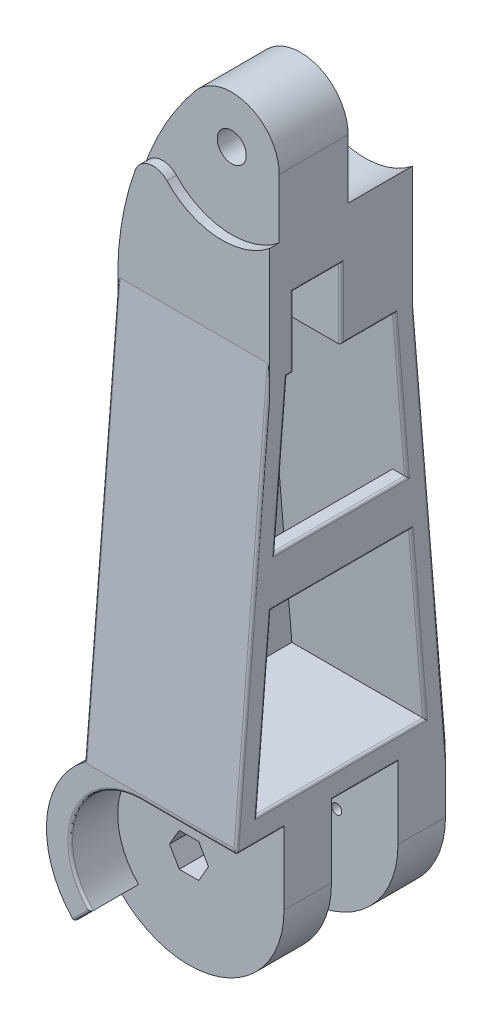
from build123d import *

# Parameters (mm, degrees)
EXTRUDE_1_DEPTH             = 22
CUT_EXTRUDE_2_DEPTH         = 2
CUT_EXTRUDE_2_DEPTH_BACK    = 12
SKETCH_17_R                 = 4
SKETCH_17_R_2               = 2.5
EXTRUDE_1181_DEPTH          = 1
CUT_EXTRUDE_4_DEPTH         = 10
CUT_EXTRUDE_5_DEPTH         = 6
CUT_EXTRUDE_6_DEPTH         = 152.662725821
CUT_EXTRUDE_START           = 13.5
CUT_EXTRUDE_7_DEPTH         = 13.5
CUT_EXTRUDE_8_DEPTH         = 2
SKETCH_15_R                 = 3.05
CUT_EXTRUDE_9_DEPTH         = 152.887565006
CUT_EXTRUDE_11_DEPTH        = 28
EXTRUDE_4_REACH             = 153.663
SKETCH_20_W                 = 3
SKETCH_20_H                 = 10
EXTRUDE_4_DIRECTION_2_REACH = 153.663
SKETCH_18_R                 = 4
SKETCH_18_R_2               = 2.55
EXTRUDE_3_DEPTH             = 1
CUT_EXTRUDE_12_REACH        = 157.559
SKETCH_19_R                 = 1.05
CUT_EXTRUDE_1_REACH         = 150.948
SKETCH_21_W                 = 10
SKETCH_21_H                 = 5
CUT_EXTRUDE_2_2_DEPTH       = 10
FILLET_2_R                  = 0.5


with BuildPart() as part:
    # 草图1 → 凸台-拉伸1 (new, symmetric)
    with BuildSketch(Plane.XY):
        with BuildLine():
            Line((0, 0), (0, 134.629120178))
            ThreePointArc((0, 134.629120178), (-6.639219361, 144.047461513), (-17.741030699, 140.959716021))
            ThreePointArc((-17.741030699, 140.959716021), (-28.328479077, 122.213775654), (-32, 101))
            Line((-32, 101), (-32, 16))
            ThreePointArc((-32, 16), (-28.94427191, -17.88854382), (0, 0))
        make_face()
    extrude(amount=EXTRUDE_1_DEPTH, both=True)

    # 草图4 → Cut-Extrude 2 (cut, two sides: drawn at the far end of the back side and taken through both)
    with BuildSketch(Plane(origin=(9.59053233, 7.02854156, 0), x_dir=(-0.3879015226350175, 0.9217008238780278, 0), z_dir=(0, 0, 1)).offset(-CUT_EXTRUDE_2_DEPTH_BACK)):
        with BuildLine():
            Line((11.067481905, 5.747460683), (18.825512358, 24.18147716))
            ThreePointArc((18.825512358, 24.18147716), (15.666408684, 40.546455603), (-0.661796586, 43.890430498))
            Line((-0.661796586, 43.890430498), (-2.549062114, 48.520573998))
            ThreePointArc((-2.549062114, 48.520573998), (-14.999680248, 30.11309285), (-2.758030453, 11.565983522))
            Line((-2.758030453, 11.565983522), (11.067481905, 5.747460683))
        make_face()
    extrude(amount=CUT_EXTRUDE_2_DEPTH + CUT_EXTRUDE_2_DEPTH_BACK, mode=Mode.SUBTRACT)

    # 草图17 → Extrude 1181 (add)
    with BuildSketch(Plane.XY.offset(-12)):
        with Locations((-20, 0)):
            Circle(SKETCH_17_R)
        with Locations((-20, 0)):
            Circle(SKETCH_17_R_2, mode=Mode.SUBTRACT)
    extrude(amount=EXTRUDE_1181_DEPTH)

    # 草图9 → 切除-拉伸4 (cut)
    with BuildSketch(Plane.XY.offset(22)):
        with BuildLine():
            Line((0, 0), (0, 15))
            Line((0, 15), (-20, 15))
            ThreePointArc((-20, 15), (-33.858192988, 5.740251485), (-30.606601718, -10.606601718))
            Line((-30.606601718, -10.606601718), (-34.142135624, -14.142135624))
            ThreePointArc((-34.142135624, -14.142135624), (-12.346331353, -18.47759065), (0, 0))
        make_face()
    extrude(amount=-CUT_EXTRUDE_4_DEPTH, mode=Mode.SUBTRACT)

    # 草图10 → 切除-旋转1 (revolve, cut)
    with BuildSketch(Plane.ZX, mode=Mode.PRIVATE) as cut_revolve_1_sk:
        Polygon((-22, -9.5), (-19, -9.5), (-19, -15.5), (-15, -15.5), (-15, -17.45), (12, -17.45), (12, -20), (-22, -20), align=None)
    revolve(cut_revolve_1_sk.sketch.rotate(Axis((-20, 0, -40.443482847), (0, 0, 1)), 180), axis=Axis((-20, 0, -40.443482847), (0, 0, 1)), mode=Mode.SUBTRACT)

    # 草图11 → 切除-拉伸5 (cut)
    with BuildSketch(Plane.XY.offset(12)):
        Polygon((-15.900813089, 0), (-17.950406544, 3.55), (-22.049593456, 3.55), (-24.099186911, 0), (-22.049593456, -3.55), (-17.950406544, -3.55), align=None)
    extrude(amount=-CUT_EXTRUDE_5_DEPTH, mode=Mode.SUBTRACT)

    # 草图12 → 切除-拉伸6 (cut, through all)
    with BuildSketch(Plane(origin=(0, 0, 0), x_dir=(0, 0, -1), z_dir=(1, 0, 0))):
        Polygon((-22, 16), (-15, 101), (-15, 144.629120178), (-22, 144.629120178), align=None)
    cut_extrude_6 = extrude(amount=-CUT_EXTRUDE_6_DEPTH, mode=Mode.SUBTRACT)

    # 镜向1: 切除-拉伸6 across plane
    add(cut_extrude_6.mirror(Plane.XY), mode=Mode.SUBTRACT)

    # 草图13 → 切除-拉伸7 (cut)
    with BuildSketch(Plane.XY.offset(-15).offset(CUT_EXTRUDE_START)):
        with BuildLine():
            ThreePointArc((0, 122.139124182), (4.422205102, 127.700916948), (6, 134.629120178))
            ThreePointArc((6, 134.629120178), (-12.571863565, 150.421064891), (-25.173189725, 129.552279274))
            ThreePointArc((-25.173189725, 129.552279274), (-21.765574137, 135.456967681), (-17.741030699, 140.959716021))
            ThreePointArc((-17.741030699, 140.959716021), (-6.639219361, 144.047461513), (0, 134.629120178))
            Line((0, 134.629120178), (0, 122.139124182))
        make_face()
        with BuildLine():
            ThreePointArc((-17.741030699, 140.959716021), (-21.765574137, 135.456967681), (-25.173189725, 129.552279274))
            ThreePointArc((-25.173189725, 129.552279274), (-23.726924285, 126.408928594), (-21.638692568, 123.650011139))
            ThreePointArc((-21.638692568, 123.650011139), (-11.114460938, 118.667980594), (0, 122.139124182))
            Line((0, 122.139124182), (0, 134.629120178))
            ThreePointArc((0, 134.629120178), (-6.639219361, 144.047461513), (-17.741030699, 140.959716021))
        make_face()
        with BuildLine():
            ThreePointArc((-21.638692568, 123.650011139), (-23.726924285, 126.408928594), (-25.173189725, 129.552279274))
            ThreePointArc((-25.173189725, 129.552279274), (-26.85902514, 125.951617289), (-28.314837565, 122.251966229))
            ThreePointArc((-28.314837565, 122.251966229), (-25.3682183, 124.820312429), (-21.638692568, 123.650011139))
        make_face()
    extrude(amount=-CUT_EXTRUDE_7_DEPTH, mode=Mode.SUBTRACT)

    # 草图14 → 切除-拉伸8 (cut)
    with BuildSketch(Plane.XY.offset(15)):
        with BuildLine():
            ThreePointArc((0, 122.139124182), (4.422205102, 127.700916948), (6, 134.629120178))
            ThreePointArc((6, 134.629120178), (-12.571863565, 150.421064891), (-25.173189725, 129.552279274))
            ThreePointArc((-25.173189725, 129.552279274), (-21.765574137, 135.456967681), (-17.741030699, 140.959716021))
            ThreePointArc((-17.741030699, 140.959716021), (-6.639219361, 144.047461513), (0, 134.629120178))
            Line((0, 134.629120178), (0, 122.139124182))
        make_face()
        with BuildLine():
            ThreePointArc((-17.741030699, 140.959716021), (-21.765574137, 135.456967681), (-25.173189725, 129.552279274))
            ThreePointArc((-25.173189725, 129.552279274), (-23.726924305, 126.408928628), (-21.638692623, 123.650011197))
            ThreePointArc((-21.638692623, 123.650011197), (-11.114460978, 118.667980597), (0, 122.139124182))
            Line((0, 122.139124182), (0, 134.629120178))
            ThreePointArc((0, 134.629120178), (-6.639219361, 144.047461513), (-17.741030699, 140.959716021))
        make_face()
        with BuildLine():
            ThreePointArc((-21.638692623, 123.650011197), (-23.726924305, 126.408928628), (-25.173189725, 129.552279274))
            ThreePointArc((-25.173189725, 129.552279274), (-26.859025168, 125.951617222), (-28.314837613, 122.251966093))
            ThreePointArc((-28.314837613, 122.251966093), (-25.36821841, 124.820312407), (-21.638692623, 123.650011197))
        make_face()
    extrude(amount=-CUT_EXTRUDE_8_DEPTH, mode=Mode.SUBTRACT)

    # 草图15 → 切除-拉伸9 (cut, through all)
    with BuildSketch(Plane(origin=(0, 0, -1.5), x_dir=(-1, 0, 0), z_dir=(0, 0, -1))):
        with Locations(Location((10, 134.629120178, 0), (0, 0, 90))):
            Circle(SKETCH_15_R)
    extrude(amount=-CUT_EXTRUDE_9_DEPTH, mode=Mode.SUBTRACT)

    # 草图16 → 切除-拉伸11 (cut)
    with BuildSketch(Plane.ZY):
        Polygon((11.315870671, 97), (17.657047142, 20), (-17.657047142, 20), (-11.315870671, 97), align=None)
    extrude(amount=CUT_EXTRUDE_11_DEPTH, mode=Mode.SUBTRACT)

    # 凸台-拉伸4: up to this plane
    extrude_4_end = Plane(origin=(-116.711777546, 97, 11.315870671), z_dir=(0, -0.0820750945403042, -0.9966261479894054))
    # 草图20 → 凸台-拉伸4 (add, up to the surface)
    with BuildSketch(Plane.XY, mode=Mode.PRIVATE) as extrude_4_sk1:
        with Locations((-1.5, 61)):
            Rectangle(SKETCH_20_W, SKETCH_20_H)
    extrude_4_tool1 = split(extrude(extrude_4_sk1.sketch, amount=EXTRUDE_4_REACH, mode=Mode.PRIVATE), bisect_by=extrude_4_end, keep=Keep.BOTH, mode=Mode.PRIVATE)
    add(extrude_4_tool1.solids().sort_by_distance((-1.5, 61, 0))[0])

    # 凸台-拉伸4 direction 2: up to this plane
    extrude_4_direction_2_end = Plane(origin=(-116.711777546, 20, -17.657047142), z_dir=(0, -0.08207509454030391, 0.9966261479894054))
    # 草图20 → 凸台-拉伸4 direction 2 (add, up to the surface)
    with BuildSketch(Plane.XY, mode=Mode.PRIVATE) as extrude_4_direction_2_sk1:
        with Locations((-1.5, 61)):
            Rectangle(SKETCH_20_W, SKETCH_20_H)
    extrude_4_direction_2_tool1 = split(extrude(extrude_4_direction_2_sk1.sketch, amount=-EXTRUDE_4_DIRECTION_2_REACH, mode=Mode.PRIVATE), bisect_by=extrude_4_direction_2_end, keep=Keep.BOTH, mode=Mode.PRIVATE)
    add(extrude_4_direction_2_tool1.solids().sort_by_distance((-1.5, 61, 0))[0])

    # 草图18 → 凸台-拉伸3 (add)
    with BuildSketch(Plane(origin=(0, 0, 2), x_dir=(-1, 0, 0), z_dir=(0, 0, -1))):
        with Locations(Location((20, 0, 0), (0, 0, 180))):
            Circle(SKETCH_18_R)
        with Locations((20, 0)):
            Circle(SKETCH_18_R_2, mode=Mode.SUBTRACT)
    extrude(amount=EXTRUDE_3_DEPTH)

    # 草图19 → 切除-拉伸12 (cut, up to next)
    with BuildSketch(Plane(origin=(0, 0, -19), x_dir=(-1, 0, 0), z_dir=(0, 0, -1)), mode=Mode.PRIVATE) as cut_extrude_12_sk1:
        with Locations((12.9, 0)):
            Circle(SKETCH_19_R)
    cut_extrude_12_tool1 = extrude(cut_extrude_12_sk1.sketch, amount=-CUT_EXTRUDE_12_REACH, mode=Mode.PRIVATE) & part.part
    # 草图19 → 切除-拉伸12 (cut, up to next)
    with BuildSketch(Plane(origin=(0, 0, -19), x_dir=(-1, 0, 0), z_dir=(0, 0, -1)), mode=Mode.PRIVATE) as cut_extrude_12_sk2:
        with Locations((27.1, 0)):
            Circle(SKETCH_19_R)
    cut_extrude_12_tool2 = extrude(cut_extrude_12_sk2.sketch, amount=-CUT_EXTRUDE_12_REACH, mode=Mode.PRIVATE) & part.part
    add(cut_extrude_12_tool1.solids().sort_by_distance((-12.9, 0, -19))[0], mode=Mode.SUBTRACT)
    add(cut_extrude_12_tool2.solids().sort_by_distance((-27.1, 0, -19))[0], mode=Mode.SUBTRACT)

    # 草图21 → 走延长线-切除-拉伸1 (cut, up to next)
    with BuildSketch(Plane(origin=(-28, 0, 0), x_dir=(0, 0, -1), z_dir=(1, 0, 0)), mode=Mode.PRIVATE) as cut_extrude_1_sk1:
        with Locations((0, 22.5)):
            Rectangle(SKETCH_21_W, SKETCH_21_H)
    cut_extrude_1_tool1 = extrude(cut_extrude_1_sk1.sketch, amount=-CUT_EXTRUDE_1_REACH, mode=Mode.PRIVATE) & part.part
    add(cut_extrude_1_tool1.solids().sort_by_distance((-28, 22.5, 0))[0], mode=Mode.SUBTRACT)

    # 草图22 → Cut-Extrude 2 2 (cut)
    with BuildSketch(Plane.XY):
        Polygon((0, 112), (-28, 97), (0, 97), align=None)
    extrude(amount=CUT_EXTRUDE_2_2_DEPTH, mode=Mode.SUBTRACT)

    # 圆角2
    # the kernel refuses this fillet: 0.5 mm, written as the material it takes off along each edge
    with BuildSketch(Plane(origin=(-32, 102.245782685, -14.897406132), x_dir=(0, -0.08207509454030396, 0.9966261479894054), z_dir=(0, -0.9966261479894054, -0.08207509454030396))) as fillet_2_piece_1_section:
        with BuildLine():
            CenterArc((FILLET_2_R, -FILLET_2_R), FILLET_2_R, 90, 90)
            Line((0, -FILLET_2_R), (0, 0))
            Line((0, 0), (FILLET_2_R, 0))
        make_face()
    fillet_2_piece_1 = extrude(amount=92.787748241, mode=Mode.PRIVATE)
    fillet_2_piece_1 = fillet_2_piece_1 - Plane(origin=(-20, 0, -14.897406132), x_dir=(-0.6, 0.8, 0), z_dir=(0, 0, 1)) * Cylinder(20, 188, mode=Mode.PRIVATE)
    fillet_2_piece_1 = split(fillet_2_piece_1, bisect_by=Plane(origin=(-32, 102.245782685, -15), z_dir=(0, 0, -1)), keep=Keep.TOP, mode=Mode.PRIVATE)
    add(fillet_2_piece_1, mode=Mode.SUBTRACT)
    with BuildSketch(Plane(origin=(-32, 102.245782685, -14.897406132), x_dir=(0, -0.08207509454030396, 0.9966261479894054), z_dir=(0, -0.9966261479894054, -0.08207509454030396))) as fillet_2_piece_2_section:
        with BuildLine():
            CenterArc((FILLET_2_R, -FILLET_2_R), FILLET_2_R, 90, 90)
            Line((0, -FILLET_2_R), (0, 0))
            Line((0, 0), (FILLET_2_R, 0))
        make_face()
    fillet_2_piece_2 = extrude(amount=92.787748241, mode=Mode.PRIVATE)
    fillet_2_piece_2 = fillet_2_piece_2 - Plane(origin=(31.121571832, 101, -14.897406132), x_dir=(-0.7741030698804483, 0.6330595842427994, 0), z_dir=(0, 0, 1)) * Cylinder(63.121571832, 188, mode=Mode.PRIVATE)
    fillet_2_piece_2 = split(fillet_2_piece_2, bisect_by=Plane(origin=(-32, 102.245782685, -15), z_dir=(0, 0, 1)), keep=Keep.TOP, mode=Mode.PRIVATE)
    add(fillet_2_piece_2, mode=Mode.SUBTRACT)
    with BuildSketch(Plane(origin=(-32, 102.245782685, 14.897406132), x_dir=(0, -0.08207509454030396, -0.9966261479894054), z_dir=(0, -0.9966261479894054, 0.08207509454030396))) as fillet_2_piece_3_section:
        with BuildLine():
            CenterArc((FILLET_2_R, FILLET_2_R), FILLET_2_R, 180, 90)
            Line((0, FILLET_2_R), (0, 0))
            Line((0, 0), (FILLET_2_R, 0))
        make_face()
    fillet_2_piece_3 = extrude(amount=92.787748241, mode=Mode.PRIVATE)
    fillet_2_piece_3 = fillet_2_piece_3 - Plane(origin=(-20, 0, 14.897406132), x_dir=(-0.6, 0.8, 0), z_dir=(0, 0, 1)) * Cylinder(20, 188, mode=Mode.PRIVATE)
    fillet_2_piece_3 = split(fillet_2_piece_3, bisect_by=Plane(origin=(-32, 102.245782685, 15), z_dir=(0, 0, 1)), keep=Keep.TOP, mode=Mode.PRIVATE)
    add(fillet_2_piece_3, mode=Mode.SUBTRACT)
    with BuildSketch(Plane(origin=(-32, 102.245782685, 14.897406132), x_dir=(0, -0.08207509454030396, -0.9966261479894054), z_dir=(0, -0.9966261479894054, 0.08207509454030396))) as fillet_2_piece_4_section:
        with BuildLine():
            CenterArc((FILLET_2_R, FILLET_2_R), FILLET_2_R, 180, 90)
            Line((0, FILLET_2_R), (0, 0))
            Line((0, 0), (FILLET_2_R, 0))
        make_face()
    fillet_2_piece_4 = extrude(amount=92.787748241, mode=Mode.PRIVATE)
    fillet_2_piece_4 = fillet_2_piece_4 - Plane(origin=(31.121571832, 101, 14.897406132), x_dir=(-0.7741030698804483, 0.6330595842427994, 0), z_dir=(0, 0, 1)) * Cylinder(63.121571832, 188, mode=Mode.PRIVATE)
    fillet_2_piece_4 = split(fillet_2_piece_4, bisect_by=Plane(origin=(-32, 102.245782685, 15), z_dir=(0, 0, -1)), keep=Keep.TOP, mode=Mode.PRIVATE)
    add(fillet_2_piece_4, mode=Mode.SUBTRACT)
    with BuildSketch(Plane(origin=(0, 9.771086575, 22.512969341), x_dir=(-1, 0, 0), z_dir=(0, 0.9966261479894054, -0.08207509454030396))) as fillet_2_piece_5_section:
        with BuildLine():
            CenterArc((FILLET_2_R, -FILLET_2_R), FILLET_2_R, 90, 90)
            Line((0, -FILLET_2_R), (0, 0))
            Line((0, 0), (FILLET_2_R, 0))
        make_face()
    fillet_2_piece_5 = extrude(amount=92.787748241, mode=Mode.PRIVATE)
    fillet_2_piece_5 = split(fillet_2_piece_5, bisect_by=Plane(origin=(0, 9.771086575, 15), z_dir=(0, 0, 1)), keep=Keep.TOP, mode=Mode.PRIVATE)
    add(fillet_2_piece_5, mode=Mode.SUBTRACT)
    with BuildSketch(Plane(origin=(0, 9.771086575, -22.512969341), x_dir=(-1, 0, 0), z_dir=(0, 0.9966261479894054, 0.08207509454030396))) as fillet_2_piece_6_section:
        with BuildLine():
            CenterArc((FILLET_2_R, FILLET_2_R), FILLET_2_R, 180, 90)
            Line((0, FILLET_2_R), (0, 0))
            Line((0, 0), (FILLET_2_R, 0))
        make_face()
    fillet_2_piece_6 = extrude(amount=92.787748241, mode=Mode.PRIVATE)
    fillet_2_piece_6 = split(fillet_2_piece_6, bisect_by=Plane(origin=(0, 9.771086575, -15), z_dir=(0, 0, -1)), keep=Keep.TOP, mode=Mode.PRIVATE)
    add(fillet_2_piece_6, mode=Mode.SUBTRACT)
    with BuildSketch(Plane(origin=(0, 20, 18.907047142), x_dir=(-1, 0, 0), z_dir=(0, 0, -1))) as fillet_2_piece_7_section:
        with BuildLine():
            CenterArc((FILLET_2_R, -FILLET_2_R), FILLET_2_R, 90, 90)
            Line((0, -FILLET_2_R), (0, 0))
            Line((0, 0), (FILLET_2_R, 0))
        make_face()
    fillet_2_piece_7 = extrude(amount=37.814094283, mode=Mode.PRIVATE)
    fillet_2_piece_7 = split(fillet_2_piece_7, bisect_by=Plane(origin=(0, 22.99087656, -17.41073966), z_dir=(0, -0.08207509454030391, 0.9966261479894054)), keep=Keep.TOP, mode=Mode.PRIVATE)
    fillet_2_piece_7 = split(fillet_2_piece_7, bisect_by=Plane(origin=(0, 19.897752268, 17.665467543), z_dir=(0, -0.08207509454030419, -0.9966261479894054)), keep=Keep.TOP, mode=Mode.PRIVATE)
    add(fillet_2_piece_7, mode=Mode.SUBTRACT)
    with BuildSketch(Plane(origin=(0, 18.754217315, -17.75964101), x_dir=(0, 0.08207509454030391, -0.9966261479894054), z_dir=(0, 0.9966261479894054, 0.08207509454030391))) as fillet_2_piece_8_section:
        with BuildLine():
            CenterArc((FILLET_2_R, FILLET_2_R), FILLET_2_R, 180, 90)
            Line((0, FILLET_2_R), (0, 0))
            Line((0, 0), (FILLET_2_R, 0))
        make_face()
    fillet_2_piece_8 = extrude(amount=38.621869843, mode=Mode.PRIVATE)
    fillet_2_piece_8 = split(fillet_2_piece_8, bisect_by=Plane(origin=(0, 20, -17.75964101), z_dir=(0, 1, 0)), keep=Keep.TOP, mode=Mode.PRIVATE)
    fillet_2_piece_8 = split(fillet_2_piece_8, bisect_by=Plane(origin=(0, 56, -17.75964101), z_dir=(0, -1, 0)), keep=Keep.TOP, mode=Mode.PRIVATE)
    add(fillet_2_piece_8, mode=Mode.SUBTRACT)
    with BuildSketch(Plane(origin=(0, 64.754217315, -13.971405716), x_dir=(0, 0.08207509454030393, -0.9966261479894055), z_dir=(0, 0.9966261479894054, 0.08207509454030391))) as fillet_2_piece_9_section:
        with BuildLine():
            CenterArc((FILLET_2_R, FILLET_2_R), FILLET_2_R, 180, 90)
            Line((0, FILLET_2_R), (0, 0))
            Line((0, 0), (FILLET_2_R, 0))
        make_face()
    fillet_2_piece_9 = extrude(amount=33.604943476, mode=Mode.PRIVATE)
    fillet_2_piece_9 = split(fillet_2_piece_9, bisect_by=Plane(origin=(0, 66, -13.971405716), z_dir=(0, 1, 0)), keep=Keep.TOP, mode=Mode.PRIVATE)
    fillet_2_piece_9 = split(fillet_2_piece_9, bisect_by=Plane(origin=(0, 97, -13.971405716), z_dir=(0, -1, 0)), keep=Keep.TOP, mode=Mode.PRIVATE)
    add(fillet_2_piece_9, mode=Mode.SUBTRACT)
    with BuildSketch(Plane(origin=(0, 97, -12.565870671), x_dir=(0, 1, 0), z_dir=(0, 0, 1))) as fillet_2_piece_10_section:
        with BuildLine():
            CenterArc((FILLET_2_R, FILLET_2_R), FILLET_2_R, 180, 90)
            Line((0, FILLET_2_R), (0, 0))
            Line((0, 0), (FILLET_2_R, 0))
        make_face()
    fillet_2_piece_10 = extrude(amount=13.815870671, mode=Mode.PRIVATE)
    fillet_2_piece_10 = split(fillet_2_piece_10, bisect_by=Plane(origin=(0, 96.897752268, -11.324291072), z_dir=(0, -0.08207509454030391, 0.9966261479894054)), keep=Keep.TOP, mode=Mode.PRIVATE)
    add(fillet_2_piece_10, mode=Mode.SUBTRACT)
    with BuildSketch(Plane(origin=(0, 97, 8.75), x_dir=(0, 1, 0), z_dir=(0, 0, 1))) as fillet_2_piece_11_section:
        with BuildLine():
            CenterArc((FILLET_2_R, FILLET_2_R), FILLET_2_R, 180, 90)
            Line((0, FILLET_2_R), (0, 0))
            Line((0, 0), (FILLET_2_R, 0))
        make_face()
    fillet_2_piece_11 = extrude(amount=3.815870671, mode=Mode.PRIVATE)
    fillet_2_piece_11 = split(fillet_2_piece_11, bisect_by=Plane(origin=(0, 97.209883565, 11.298586142), z_dir=(0, -0.08207509454030419, -0.9966261479894054)), keep=Keep.TOP, mode=Mode.PRIVATE)
    add(fillet_2_piece_11, mode=Mode.SUBTRACT)
    with BuildSketch(Plane(origin=(0, 57.245782685, 14.589747391), x_dir=(0, 0.08207509454030419, 0.9966261479894054), z_dir=(0, -0.9966261479894054, 0.08207509454030419))) as fillet_2_piece_12_section:
        with BuildLine():
            CenterArc((FILLET_2_R, FILLET_2_R), FILLET_2_R, 180, 90)
            Line((0, FILLET_2_R), (0, 0))
            Line((0, 0), (FILLET_2_R, 0))
        make_face()
    fillet_2_piece_12 = extrude(amount=38.621869843, mode=Mode.PRIVATE)
    fillet_2_piece_12 = split(fillet_2_piece_12, bisect_by=Plane(origin=(0, 20, 14.589747391), z_dir=(0, 1, 0)), keep=Keep.TOP, mode=Mode.PRIVATE)
    fillet_2_piece_12 = split(fillet_2_piece_12, bisect_by=Plane(origin=(0, 56, 14.589747391), z_dir=(0, -1, 0)), keep=Keep.TOP, mode=Mode.PRIVATE)
    add(fillet_2_piece_12, mode=Mode.SUBTRACT)
    with BuildSketch(Plane(origin=(0, 98.245782685, 11.213276803), x_dir=(0, 0.0820750945403042, 0.9966261479894055), z_dir=(0, -0.9966261479894054, 0.08207509454030419))) as fillet_2_piece_13_section:
        with BuildLine():
            CenterArc((FILLET_2_R, FILLET_2_R), FILLET_2_R, 180, 90)
            Line((0, FILLET_2_R), (0, 0))
            Line((0, 0), (FILLET_2_R, 0))
        make_face()
    fillet_2_piece_13 = extrude(amount=33.604943476, mode=Mode.PRIVATE)
    fillet_2_piece_13 = split(fillet_2_piece_13, bisect_by=Plane(origin=(0, 66, 11.213276803), z_dir=(0, 1, 0)), keep=Keep.TOP, mode=Mode.PRIVATE)
    fillet_2_piece_13 = split(fillet_2_piece_13, bisect_by=Plane(origin=(0, 97, 11.213276803), z_dir=(0, -1, 0)), keep=Keep.TOP, mode=Mode.PRIVATE)
    add(fillet_2_piece_13, mode=Mode.SUBTRACT)
    with BuildSketch(Plane(origin=(1.25, 15, 22), x_dir=(0, 1, 0), z_dir=(-1, 0, 0))) as fillet_2_piece_14:
        with BuildLine():
            CenterArc((FILLET_2_R, FILLET_2_R), FILLET_2_R, 180, 90)
            Line((0, FILLET_2_R), (0, 0))
            Line((0, 0), (FILLET_2_R, 0))
        make_face()
    extrude(amount=21.25, mode=Mode.SUBTRACT)
    with BuildSketch(Plane(origin=(-34.142135624, -14.142135624, 2), x_dir=(-0.6979824404521097, 0.7161148740394359, 0), z_dir=(0, 0, -1))) as fillet_2_piece_15:
        with BuildLine():
            CenterArc((0.506451887, 0.4999589), FILLET_2_R, 179.265358209, 91.469283581)
            Line((0.006492986, 0.506369684), (0, 0))
            ThreePointArc((0, 0), (0.256431335, -0.001643993), (0.51286267, 0))
        make_face()
    extrude(amount=14, mode=Mode.SUBTRACT)
    with BuildSketch(Plane(origin=(-29.722718241, -9.722718241, 22), x_dir=(-0.7071067811865442, 0.7071067811865509, 0), z_dir=(-0.7071067811865509, -0.7071067811865442, 0))) as fillet_2_piece_16:
        with BuildLine():
            CenterArc((FILLET_2_R, FILLET_2_R), FILLET_2_R, 180, 90)
            Line((0, FILLET_2_R), (0, 0))
            Line((0, 0), (FILLET_2_R, 0))
        make_face()
    extrude(amount=7.5, mode=Mode.SUBTRACT)
    with BuildSketch(Plane(origin=(-34.142135624, -14.142135624, 23.282156675), x_dir=(-0.6979824404521096, 0.7161148740394361, 0), z_dir=(0, 0, -1))) as fillet_2_piece_17:
        with BuildLine():
            CenterArc((0.506451887, 0.4999589), FILLET_2_R, 179.265358209, 91.469283581)
            Line((0.006492986, 0.506369684), (0, 0))
            ThreePointArc((0, 0), (0.256431335, -0.001643993), (0.51286267, 0))
        make_face()
    extrude(amount=11.282156675, mode=Mode.SUBTRACT)
    with BuildSketch(Plane(origin=(-20, 0, 22), x_dir=(0, 1, 0), z_dir=(1, 0, 0))) as fillet_2_piece_18:
        with BuildLine():
            CenterArc((15 + FILLET_2_R, -FILLET_2_R), FILLET_2_R, 90, 90)
            Line((15, -FILLET_2_R), (15, 0))
            Line((15, 0), (15 + FILLET_2_R, 0))
        make_face()
    revolve(axis=Axis((-20, 0, 22), (0, 0, 1)), revolution_arc=139.778965344, mode=Mode.SUBTRACT)
    with BuildSketch(Plane(origin=(0, 15, 23.25), x_dir=(0, 1, 0), z_dir=(0, 0, -1))) as fillet_2_piece_19:
        with BuildLine():
            CenterArc((FILLET_2_R, -FILLET_2_R), FILLET_2_R, 90, 90)
            Line((0, -FILLET_2_R), (0, 0))
            Line((0, 0), (FILLET_2_R, 0))
        make_face()
    extrude(amount=11.25, mode=Mode.SUBTRACT)
    with BuildSketch(Plane(origin=(0, 15, -12), x_dir=(0, 1, 0), z_dir=(0, 0, 1))) as fillet_2_piece_20:
        with BuildLine():
            CenterArc((FILLET_2_R, FILLET_2_R), FILLET_2_R, 180, 90)
            Line((0, FILLET_2_R), (0, 0))
            Line((0, 0), (FILLET_2_R, 0))
        make_face()
    extrude(amount=14, mode=Mode.SUBTRACT)
    with BuildSketch(Plane(origin=(0, 56, 15.942341259), x_dir=(0, 1, 0), z_dir=(0, 0, -1))) as fillet_2_piece_21_section:
        with BuildLine():
            CenterArc((FILLET_2_R, -FILLET_2_R), FILLET_2_R, 90, 90)
            Line((0, -FILLET_2_R), (0, 0))
            Line((0, 0), (FILLET_2_R, 0))
        make_face()
    fillet_2_piece_21 = extrude(amount=31.884682519, mode=Mode.PRIVATE)
    fillet_2_piece_21 = split(fillet_2_piece_21, bisect_by=Plane(origin=(0, 58.505861438, -14.4859762), z_dir=(0, -0.08207509454030391, 0.9966261479894054)), keep=Keep.TOP, mode=Mode.PRIVATE)
    fillet_2_piece_21 = split(fillet_2_piece_21, bisect_by=Plane(origin=(0, 55.897752268, 14.700761661), z_dir=(0, -0.08207509454030419, -0.9966261479894054)), keep=Keep.TOP, mode=Mode.PRIVATE)
    add(fillet_2_piece_21, mode=Mode.SUBTRACT)
    with BuildSketch(Plane(origin=(0, 66, -15.118811847), x_dir=(0, -1, 0), z_dir=(0, 0, 1))) as fillet_2_piece_22_section:
        with BuildLine():
            CenterArc((FILLET_2_R, -FILLET_2_R), FILLET_2_R, 90, 90)
            Line((0, -FILLET_2_R), (0, 0))
            Line((0, 0), (FILLET_2_R, 0))
        make_face()
    fillet_2_piece_22 = extrude(amount=30.237623695, mode=Mode.PRIVATE)
    fillet_2_piece_22 = split(fillet_2_piece_22, bisect_by=Plane(origin=(0, 65.897752268, -13.877232249), z_dir=(0, -0.08207509454030391, 0.9966261479894054)), keep=Keep.TOP, mode=Mode.PRIVATE)
    fillet_2_piece_22 = split(fillet_2_piece_22, bisect_by=Plane(origin=(0, 68.371135015, 13.673541905), z_dir=(0, -0.08207509454030419, -0.9966261479894054)), keep=Keep.TOP, mode=Mode.PRIVATE)
    add(fillet_2_piece_22, mode=Mode.SUBTRACT)
    with BuildSketch(Plane(origin=(-32, 25, -5), x_dir=(0, 1, 0), z_dir=(0, 0, 1)), Plane(origin=(-32, 20, 5), x_dir=(0, -1, 0), z_dir=(0, 0, -1))) as fillet_2_piece_23:
        with BuildLine():
            CenterArc((FILLET_2_R, -FILLET_2_R), FILLET_2_R, 90, 90)
            Line((0, -FILLET_2_R), (0, 0))
            Line((0, 0), (FILLET_2_R, 0))
        make_face()
    extrude(amount=10, mode=Mode.SUBTRACT)
    with BuildSketch(Plane(origin=(-32, 20, -5), x_dir=(0, 0, -1), z_dir=(0, 1, 0)), Plane(origin=(-32, 25, 5), x_dir=(0, 0, 1), z_dir=(0, -1, 0))) as fillet_2_piece_24:
        with BuildLine():
            CenterArc((FILLET_2_R, -FILLET_2_R), FILLET_2_R, 90, 90)
            Line((0, -FILLET_2_R), (0, 0))
            Line((0, 0), (FILLET_2_R, 0))
        make_face()
    extrude(amount=5, mode=Mode.SUBTRACT)
    with BuildSketch(Plane(origin=(0, 95.75, 10), x_dir=(0, 0, 1), z_dir=(0, 1, 0))) as fillet_2_piece_25_section:
        with BuildLine():
            CenterArc((FILLET_2_R, -FILLET_2_R), FILLET_2_R, 90, 90)
            Line((0, -FILLET_2_R), (0, 0))
            Line((0, 0), (FILLET_2_R, 0))
        make_face()
    fillet_2_piece_25 = extrude(amount=17.5, mode=Mode.PRIVATE)
    fillet_2_piece_25 = split(fillet_2_piece_25, bisect_by=Plane(origin=(-6.764122894, 108.376362735, 10), z_dir=(0.4722214125154187, -0.8814799700287823, 0)), keep=Keep.TOP, mode=Mode.PRIVATE)
    add(fillet_2_piece_25, mode=Mode.SUBTRACT)
    with BuildSketch(Plane(origin=(0, 112, 0), x_dir=(0, 1, 0), z_dir=(0, 0, 1))) as fillet_2_piece_26:
        with BuildLine():
            CenterArc((FILLET_2_R * 0.598741441019, FILLET_2_R), FILLET_2_R, 208.17859011, 61.82140989)
            Line((-FILLET_2_R * 0.28273852901, FILLET_2_R * 0.527778587485), (0, 0))
            Line((0, 0), (FILLET_2_R * 0.598741441019, 0))
        make_face()
    extrude(amount=10, mode=Mode.SUBTRACT)
    with BuildSketch(Plane(origin=(0, 95.75, 0), x_dir=(0, 0, -1), z_dir=(0, 1, 0))) as fillet_2_piece_27_section:
        with BuildLine():
            CenterArc((FILLET_2_R, FILLET_2_R), FILLET_2_R, 180, 90)
            Line((0, FILLET_2_R), (0, 0))
            Line((0, 0), (FILLET_2_R, 0))
        make_face()
    fillet_2_piece_27 = extrude(amount=17.5, mode=Mode.PRIVATE)
    fillet_2_piece_27 = split(fillet_2_piece_27, bisect_by=Plane(origin=(-6.764122894, 108.376362735, 0), z_dir=(0.4722214125154187, -0.8814799700287823, 0)), keep=Keep.TOP, mode=Mode.PRIVATE)
    add(fillet_2_piece_27, mode=Mode.SUBTRACT)
    with BuildSketch(Plane(origin=(0, 20, 18.907047142), x_dir=(-1, 0, 0), z_dir=(0, 0, -1))) as fillet_2_piece_28a_section:
        with BuildLine():
            CenterArc((FILLET_2_R, -FILLET_2_R), FILLET_2_R, 90, 90)
            Line((0, -FILLET_2_R), (0, 0))
            Line((0, 0), (FILLET_2_R, 0))
        make_face()
    fillet_2_piece_28a = extrude(amount=37.814094283, mode=Mode.PRIVATE)
    fillet_2_piece_28a = split(fillet_2_piece_28a, bisect_by=Plane(origin=(0, 19.897752268, 17.665467543), z_dir=(0, 0.08207509454030419, 0.9966261479894054)), keep=Keep.TOP, mode=Mode.PRIVATE)
    with BuildSketch(Plane(origin=(0, 57.245782685, 14.589747391), x_dir=(0, 0.08207509454030419, 0.9966261479894054), z_dir=(0, -0.9966261479894054, 0.08207509454030419))) as fillet_2_piece_28b_section:
        with BuildLine():
            CenterArc((FILLET_2_R, FILLET_2_R), FILLET_2_R, 180, 90)
            Line((0, FILLET_2_R), (0, 0))
            Line((0, 0), (FILLET_2_R, 0))
        make_face()
    fillet_2_piece_28b = extrude(amount=38.621869843, mode=Mode.PRIVATE)
    fillet_2_piece_28b = split(fillet_2_piece_28b, bisect_by=Plane(origin=(0, 20, 14.589747391), z_dir=(0, -1, 0)), keep=Keep.TOP, mode=Mode.PRIVATE)
    fillet_2_piece_28 = fillet_2_piece_28a & fillet_2_piece_28b
    add(fillet_2_piece_28, mode=Mode.SUBTRACT)
    with BuildSketch(Plane(origin=(0, 20, 18.907047142), x_dir=(-1, 0, 0), z_dir=(0, 0, -1))) as fillet_2_piece_29a_section:
        with BuildLine():
            CenterArc((FILLET_2_R, -FILLET_2_R), FILLET_2_R, 90, 90)
            Line((0, -FILLET_2_R), (0, 0))
            Line((0, 0), (FILLET_2_R, 0))
        make_face()
    fillet_2_piece_29a = extrude(amount=37.814094283, mode=Mode.PRIVATE)
    fillet_2_piece_29a = split(fillet_2_piece_29a, bisect_by=Plane(origin=(0, 22.99087656, -17.41073966), z_dir=(0, 0.08207509454030391, -0.9966261479894054)), keep=Keep.TOP, mode=Mode.PRIVATE)
    with BuildSketch(Plane(origin=(0, 18.754217315, -17.75964101), x_dir=(0, 0.08207509454030391, -0.9966261479894054), z_dir=(0, 0.9966261479894054, 0.08207509454030391))) as fillet_2_piece_29b_section:
        with BuildLine():
            CenterArc((FILLET_2_R, FILLET_2_R), FILLET_2_R, 180, 90)
            Line((0, FILLET_2_R), (0, 0))
            Line((0, 0), (FILLET_2_R, 0))
        make_face()
    fillet_2_piece_29b = extrude(amount=38.621869843, mode=Mode.PRIVATE)
    fillet_2_piece_29b = split(fillet_2_piece_29b, bisect_by=Plane(origin=(0, 20, -17.75964101), z_dir=(0, -1, 0)), keep=Keep.TOP, mode=Mode.PRIVATE)
    fillet_2_piece_29 = fillet_2_piece_29a & fillet_2_piece_29b
    add(fillet_2_piece_29, mode=Mode.SUBTRACT)
    with BuildSketch(Plane(origin=(0, 18.754217315, -17.75964101), x_dir=(0, 0.08207509454030391, -0.9966261479894054), z_dir=(0, 0.9966261479894054, 0.08207509454030391))) as fillet_2_piece_30a_section:
        with BuildLine():
            CenterArc((FILLET_2_R, FILLET_2_R), FILLET_2_R, 180, 90)
            Line((0, FILLET_2_R), (0, 0))
            Line((0, 0), (FILLET_2_R, 0))
        make_face()
    fillet_2_piece_30a = extrude(amount=38.621869843, mode=Mode.PRIVATE)
    fillet_2_piece_30a = split(fillet_2_piece_30a, bisect_by=Plane(origin=(0, 56, -17.75964101), z_dir=(0, 1, 0)), keep=Keep.TOP, mode=Mode.PRIVATE)
    with BuildSketch(Plane(origin=(0, 56, 15.942341259), x_dir=(0, 1, 0), z_dir=(0, 0, -1))) as fillet_2_piece_30b_section:
        with BuildLine():
            CenterArc((FILLET_2_R, -FILLET_2_R), FILLET_2_R, 90, 90)
            Line((0, -FILLET_2_R), (0, 0))
            Line((0, 0), (FILLET_2_R, 0))
        make_face()
    fillet_2_piece_30b = extrude(amount=31.884682519, mode=Mode.PRIVATE)
    fillet_2_piece_30b = split(fillet_2_piece_30b, bisect_by=Plane(origin=(0, 58.505861438, -14.4859762), z_dir=(0, 0.08207509454030391, -0.9966261479894054)), keep=Keep.TOP, mode=Mode.PRIVATE)
    fillet_2_piece_30 = fillet_2_piece_30a & fillet_2_piece_30b
    add(fillet_2_piece_30, mode=Mode.SUBTRACT)
    with BuildSketch(Plane(origin=(0, 66, -15.118811847), x_dir=(0, -1, 0), z_dir=(0, 0, 1))) as fillet_2_piece_31a_section:
        with BuildLine():
            CenterArc((FILLET_2_R, -FILLET_2_R), FILLET_2_R, 90, 90)
            Line((0, -FILLET_2_R), (0, 0))
            Line((0, 0), (FILLET_2_R, 0))
        make_face()
    fillet_2_piece_31a = extrude(amount=30.237623695, mode=Mode.PRIVATE)
    fillet_2_piece_31a = split(fillet_2_piece_31a, bisect_by=Plane(origin=(0, 65.897752268, -13.877232249), z_dir=(0, 0.08207509454030391, -0.9966261479894054)), keep=Keep.TOP, mode=Mode.PRIVATE)
    with BuildSketch(Plane(origin=(0, 64.754217315, -13.971405716), x_dir=(0, 0.08207509454030393, -0.9966261479894055), z_dir=(0, 0.9966261479894054, 0.08207509454030391))) as fillet_2_piece_31b_section:
        with BuildLine():
            CenterArc((FILLET_2_R, FILLET_2_R), FILLET_2_R, 180, 90)
            Line((0, FILLET_2_R), (0, 0))
            Line((0, 0), (FILLET_2_R, 0))
        make_face()
    fillet_2_piece_31b = extrude(amount=33.604943476, mode=Mode.PRIVATE)
    fillet_2_piece_31b = split(fillet_2_piece_31b, bisect_by=Plane(origin=(0, 66, -13.971405716), z_dir=(0, -1, 0)), keep=Keep.TOP, mode=Mode.PRIVATE)
    fillet_2_piece_31 = fillet_2_piece_31a & fillet_2_piece_31b
    add(fillet_2_piece_31, mode=Mode.SUBTRACT)
    with BuildSketch(Plane(origin=(0, 64.754217315, -13.971405716), x_dir=(0, 0.08207509454030393, -0.9966261479894055), z_dir=(0, 0.9966261479894054, 0.08207509454030391))) as fillet_2_piece_32a_section:
        with BuildLine():
            CenterArc((FILLET_2_R, FILLET_2_R), FILLET_2_R, 180, 90)
            Line((0, FILLET_2_R), (0, 0))
            Line((0, 0), (FILLET_2_R, 0))
        make_face()
    fillet_2_piece_32a = extrude(amount=33.604943476, mode=Mode.PRIVATE)
    fillet_2_piece_32a = split(fillet_2_piece_32a, bisect_by=Plane(origin=(0, 97, -13.971405716), z_dir=(0, 1, 0)), keep=Keep.TOP, mode=Mode.PRIVATE)
    with BuildSketch(Plane(origin=(0, 97, -12.565870671), x_dir=(0, 1, 0), z_dir=(0, 0, 1))) as fillet_2_piece_32b_section:
        with BuildLine():
            CenterArc((FILLET_2_R, FILLET_2_R), FILLET_2_R, 180, 90)
            Line((0, FILLET_2_R), (0, 0))
            Line((0, 0), (FILLET_2_R, 0))
        make_face()
    fillet_2_piece_32b = extrude(amount=12.565870671, mode=Mode.PRIVATE)
    fillet_2_piece_32b = split(fillet_2_piece_32b, bisect_by=Plane(origin=(0, 96.897752268, -11.324291072), z_dir=(0, 0.08207509454030391, -0.9966261479894054)), keep=Keep.TOP, mode=Mode.PRIVATE)
    fillet_2_piece_32 = fillet_2_piece_32a & fillet_2_piece_32b
    add(fillet_2_piece_32, mode=Mode.SUBTRACT)
    with BuildSketch(Plane(origin=(0, 98.245782685, 11.213276803), x_dir=(0, 0.0820750945403042, 0.9966261479894055), z_dir=(0, -0.9966261479894054, 0.08207509454030419))) as fillet_2_piece_33a_section:
        with BuildLine():
            CenterArc((FILLET_2_R, FILLET_2_R), FILLET_2_R, 180, 90)
            Line((0, FILLET_2_R), (0, 0))
            Line((0, 0), (FILLET_2_R, 0))
        make_face()
    fillet_2_piece_33a = extrude(amount=33.604943476, mode=Mode.PRIVATE)
    fillet_2_piece_33a = split(fillet_2_piece_33a, bisect_by=Plane(origin=(0, 97, 11.213276803), z_dir=(0, 1, 0)), keep=Keep.TOP, mode=Mode.PRIVATE)
    with BuildSketch(Plane(origin=(0, 97, 10), x_dir=(0, 1, 0), z_dir=(0, 0, 1))) as fillet_2_piece_33b_section:
        with BuildLine():
            CenterArc((FILLET_2_R, FILLET_2_R), FILLET_2_R, 180, 90)
            Line((0, FILLET_2_R), (0, 0))
            Line((0, 0), (FILLET_2_R, 0))
        make_face()
    fillet_2_piece_33b = extrude(amount=2.565870671, mode=Mode.PRIVATE)
    fillet_2_piece_33b = split(fillet_2_piece_33b, bisect_by=Plane(origin=(0, 97.107635833, 11.307006544), z_dir=(0, 0.08207509454030419, 0.9966261479894054)), keep=Keep.TOP, mode=Mode.PRIVATE)
    fillet_2_piece_33 = fillet_2_piece_33a & fillet_2_piece_33b
    add(fillet_2_piece_33, mode=Mode.SUBTRACT)
    with BuildSketch(Plane(origin=(0, 56, 15.942341259), x_dir=(0, 1, 0), z_dir=(0, 0, -1))) as fillet_2_piece_34a_section:
        with BuildLine():
            CenterArc((FILLET_2_R, -FILLET_2_R), FILLET_2_R, 90, 90)
            Line((0, -FILLET_2_R), (0, 0))
            Line((0, 0), (FILLET_2_R, 0))
        make_face()
    fillet_2_piece_34a = extrude(amount=31.884682519, mode=Mode.PRIVATE)
    fillet_2_piece_34a = split(fillet_2_piece_34a, bisect_by=Plane(origin=(0, 55.897752268, 14.700761661), z_dir=(0, 0.08207509454030419, 0.9966261479894054)), keep=Keep.TOP, mode=Mode.PRIVATE)
    with BuildSketch(Plane(origin=(0, 57.245782685, 14.589747391), x_dir=(0, 0.08207509454030419, 0.9966261479894054), z_dir=(0, -0.9966261479894054, 0.08207509454030419))) as fillet_2_piece_34b_section:
        with BuildLine():
            CenterArc((FILLET_2_R, FILLET_2_R), FILLET_2_R, 180, 90)
            Line((0, FILLET_2_R), (0, 0))
            Line((0, 0), (FILLET_2_R, 0))
        make_face()
    fillet_2_piece_34b = extrude(amount=38.621869843, mode=Mode.PRIVATE)
    fillet_2_piece_34b = split(fillet_2_piece_34b, bisect_by=Plane(origin=(0, 56, 14.589747391), z_dir=(0, 1, 0)), keep=Keep.TOP, mode=Mode.PRIVATE)
    fillet_2_piece_34 = fillet_2_piece_34a & fillet_2_piece_34b
    add(fillet_2_piece_34, mode=Mode.SUBTRACT)
    with BuildSketch(Plane(origin=(0, 98.245782685, 11.213276803), x_dir=(0, 0.0820750945403042, 0.9966261479894055), z_dir=(0, -0.9966261479894054, 0.08207509454030419))) as fillet_2_piece_35a_section:
        with BuildLine():
            CenterArc((FILLET_2_R, FILLET_2_R), FILLET_2_R, 180, 90)
            Line((0, FILLET_2_R), (0, 0))
            Line((0, 0), (FILLET_2_R, 0))
        make_face()
    fillet_2_piece_35a = extrude(amount=33.604943476, mode=Mode.PRIVATE)
    fillet_2_piece_35a = split(fillet_2_piece_35a, bisect_by=Plane(origin=(0, 66, 11.213276803), z_dir=(0, -1, 0)), keep=Keep.TOP, mode=Mode.PRIVATE)
    with BuildSketch(Plane(origin=(0, 66, -15.118811847), x_dir=(0, -1, 0), z_dir=(0, 0, 1))) as fillet_2_piece_35b_section:
        with BuildLine():
            CenterArc((FILLET_2_R, -FILLET_2_R), FILLET_2_R, 90, 90)
            Line((0, -FILLET_2_R), (0, 0))
            Line((0, 0), (FILLET_2_R, 0))
        make_face()
    fillet_2_piece_35b = extrude(amount=30.237623695, mode=Mode.PRIVATE)
    fillet_2_piece_35b = split(fillet_2_piece_35b, bisect_by=Plane(origin=(0, 68.371135015, 13.673541905), z_dir=(0, 0.08207509454030419, 0.9966261479894054)), keep=Keep.TOP, mode=Mode.PRIVATE)
    fillet_2_piece_35 = fillet_2_piece_35a & fillet_2_piece_35b
    add(fillet_2_piece_35, mode=Mode.SUBTRACT)
    with BuildSketch(Plane(origin=(-32, 25, -6.25), x_dir=(0, 1, 0), z_dir=(0, 0, 1))) as fillet_2_piece_36a_section:
        with BuildLine():
            CenterArc((FILLET_2_R, -FILLET_2_R), FILLET_2_R, 90, 90)
            Line((0, -FILLET_2_R), (0, 0))
            Line((0, 0), (FILLET_2_R, 0))
        make_face()
    fillet_2_piece_36a = extrude(amount=11.25, mode=Mode.PRIVATE)
    fillet_2_piece_36a = split(fillet_2_piece_36a, bisect_by=Plane(origin=(-32, 25, -5), z_dir=(0, 0, -1)), keep=Keep.TOP, mode=Mode.PRIVATE)
    with BuildSketch(Plane(origin=(-32, 20, -5), x_dir=(0, 0, -1), z_dir=(0, 1, 0))) as fillet_2_piece_36b_section:
        with BuildLine():
            CenterArc((FILLET_2_R, -FILLET_2_R), FILLET_2_R, 90, 90)
            Line((0, -FILLET_2_R), (0, 0))
            Line((0, 0), (FILLET_2_R, 0))
        make_face()
    fillet_2_piece_36b = extrude(amount=6.25, mode=Mode.PRIVATE)
    fillet_2_piece_36b = split(fillet_2_piece_36b, bisect_by=Plane(origin=(-32, 25, -5), z_dir=(0, 1, 0)), keep=Keep.TOP, mode=Mode.PRIVATE)
    fillet_2_piece_36 = fillet_2_piece_36a & fillet_2_piece_36b
    add(fillet_2_piece_36, mode=Mode.SUBTRACT)
    with BuildSketch(Plane(origin=(-32, 26.25, 5), x_dir=(0, 0, 1), z_dir=(0, -1, 0))) as fillet_2_piece_37a_section:
        with BuildLine():
            CenterArc((FILLET_2_R, -FILLET_2_R), FILLET_2_R, 90, 90)
            Line((0, -FILLET_2_R), (0, 0))
            Line((0, 0), (FILLET_2_R, 0))
        make_face()
    fillet_2_piece_37a = extrude(amount=6.25, mode=Mode.PRIVATE)
    fillet_2_piece_37a = split(fillet_2_piece_37a, bisect_by=Plane(origin=(-32, 25, 5), z_dir=(0, 1, 0)), keep=Keep.TOP, mode=Mode.PRIVATE)
    with BuildSketch(Plane(origin=(-32, 25, -5), x_dir=(0, 1, 0), z_dir=(0, 0, 1))) as fillet_2_piece_37b_section:
        with BuildLine():
            CenterArc((FILLET_2_R, -FILLET_2_R), FILLET_2_R, 90, 90)
            Line((0, -FILLET_2_R), (0, 0))
            Line((0, 0), (FILLET_2_R, 0))
        make_face()
    fillet_2_piece_37b = extrude(amount=11.25, mode=Mode.PRIVATE)
    fillet_2_piece_37b = split(fillet_2_piece_37b, bisect_by=Plane(origin=(-32, 25, 5), z_dir=(0, 0, 1)), keep=Keep.TOP, mode=Mode.PRIVATE)
    fillet_2_piece_37 = fillet_2_piece_37a & fillet_2_piece_37b
    add(fillet_2_piece_37, mode=Mode.SUBTRACT)
    with BuildSketch(Plane(origin=(-32, 18.75, -5), x_dir=(0, 0, -1), z_dir=(0, 1, 0))) as fillet_2_piece_38a_section:
        with BuildLine():
            CenterArc((FILLET_2_R, -FILLET_2_R), FILLET_2_R, 90, 90)
            Line((0, -FILLET_2_R), (0, 0))
            Line((0, 0), (FILLET_2_R, 0))
        make_face()
    fillet_2_piece_38a = extrude(amount=6.25, mode=Mode.PRIVATE)
    fillet_2_piece_38a = split(fillet_2_piece_38a, bisect_by=Plane(origin=(-32, 20, -5), z_dir=(0, -1, 0)), keep=Keep.TOP, mode=Mode.PRIVATE)
    with BuildSketch(Plane(origin=(-32, 20, 5), x_dir=(0, -1, 0), z_dir=(0, 0, -1))) as fillet_2_piece_38b_section:
        with BuildLine():
            CenterArc((FILLET_2_R, -FILLET_2_R), FILLET_2_R, 90, 90)
            Line((0, -FILLET_2_R), (0, 0))
            Line((0, 0), (FILLET_2_R, 0))
        make_face()
    fillet_2_piece_38b = extrude(amount=11.25, mode=Mode.PRIVATE)
    fillet_2_piece_38b = split(fillet_2_piece_38b, bisect_by=Plane(origin=(-32, 20, -5), z_dir=(0, 0, -1)), keep=Keep.TOP, mode=Mode.PRIVATE)
    fillet_2_piece_38 = fillet_2_piece_38a & fillet_2_piece_38b
    add(fillet_2_piece_38, mode=Mode.SUBTRACT)
    with BuildSketch(Plane(origin=(-32, 25, 5), x_dir=(0, 0, 1), z_dir=(0, -1, 0))) as fillet_2_piece_39a_section:
        with BuildLine():
            CenterArc((FILLET_2_R, -FILLET_2_R), FILLET_2_R, 90, 90)
            Line((0, -FILLET_2_R), (0, 0))
            Line((0, 0), (FILLET_2_R, 0))
        make_face()
    fillet_2_piece_39a = extrude(amount=6.25, mode=Mode.PRIVATE)
    fillet_2_piece_39a = split(fillet_2_piece_39a, bisect_by=Plane(origin=(-32, 20, 5), z_dir=(0, -1, 0)), keep=Keep.TOP, mode=Mode.PRIVATE)
    with BuildSketch(Plane(origin=(-32, 20, 6.25), x_dir=(0, -1, 0), z_dir=(0, 0, -1))) as fillet_2_piece_39b_section:
        with BuildLine():
            CenterArc((FILLET_2_R, -FILLET_2_R), FILLET_2_R, 90, 90)
            Line((0, -FILLET_2_R), (0, 0))
            Line((0, 0), (FILLET_2_R, 0))
        make_face()
    fillet_2_piece_39b = extrude(amount=11.25, mode=Mode.PRIVATE)
    fillet_2_piece_39b = split(fillet_2_piece_39b, bisect_by=Plane(origin=(-32, 20, 5), z_dir=(0, 0, 1)), keep=Keep.TOP, mode=Mode.PRIVATE)
    fillet_2_piece_39 = fillet_2_piece_39a & fillet_2_piece_39b
    add(fillet_2_piece_39, mode=Mode.SUBTRACT)
    with BuildSketch(Plane(origin=(0, 112, 0), x_dir=(0, 1, 0), z_dir=(0, 0, 1))) as fillet_2_piece_40a_section:
        with BuildLine():
            CenterArc((FILLET_2_R * 0.598741441019, FILLET_2_R), FILLET_2_R, 208.17859011, 61.82140989)
            Line((-FILLET_2_R * 0.28273852901, FILLET_2_R * 0.527778587485), (0, 0))
            Line((0, 0), (FILLET_2_R * 0.598741441019, 0))
        make_face()
    fillet_2_piece_40a = extrude(amount=10.748426801, mode=Mode.PRIVATE)
    fillet_2_piece_40a = split(fillet_2_piece_40a, bisect_by=Plane(origin=(0, 112, 10), z_dir=(0, 0, 1)), keep=Keep.TOP, mode=Mode.PRIVATE)
    with BuildSketch(Plane(origin=(0, 97, 10), x_dir=(0, 0, 1), z_dir=(0, 1, 0))) as fillet_2_piece_40b_section:
        with BuildLine():
            CenterArc((FILLET_2_R, -FILLET_2_R), FILLET_2_R, 90, 90)
            Line((0, -FILLET_2_R), (0, 0))
            Line((0, 0), (FILLET_2_R, 0))
        make_face()
    fillet_2_piece_40b = extrude(amount=16.25, mode=Mode.PRIVATE)
    fillet_2_piece_40b = split(fillet_2_piece_40b, bisect_by=Plane(origin=(-6.243805748, 108.655104063, 10), z_dir=(-0.4722214125154187, 0.8814799700287823, 0)), keep=Keep.TOP, mode=Mode.PRIVATE)
    fillet_2_piece_40 = fillet_2_piece_40a & fillet_2_piece_40b
    add(fillet_2_piece_40, mode=Mode.SUBTRACT)
    with BuildSketch(Plane(origin=(0, 97, 0), x_dir=(0, 0, -1), z_dir=(0, 1, 0))) as fillet_2_piece_41a_section:
        with BuildLine():
            CenterArc((FILLET_2_R, FILLET_2_R), FILLET_2_R, 180, 90)
            Line((0, FILLET_2_R), (0, 0))
            Line((0, 0), (FILLET_2_R, 0))
        make_face()
    fillet_2_piece_41a = extrude(amount=16.25, mode=Mode.PRIVATE)
    fillet_2_piece_41a = split(fillet_2_piece_41a, bisect_by=Plane(origin=(-6.243805748, 108.655104063, 0), z_dir=(-0.4722214125154187, 0.8814799700287823, 0)), keep=Keep.TOP, mode=Mode.PRIVATE)
    with BuildSketch(Plane(origin=(0, 112, -0.748426801), x_dir=(0, 1, 0), z_dir=(0, 0, 1))) as fillet_2_piece_41b_section:
        with BuildLine():
            CenterArc((FILLET_2_R * 0.598741441019, FILLET_2_R), FILLET_2_R, 208.17859011, 61.82140989)
            Line((-FILLET_2_R * 0.28273852901, FILLET_2_R * 0.527778587485), (0, 0))
            Line((0, 0), (FILLET_2_R * 0.598741441019, 0))
        make_face()
    fillet_2_piece_41b = extrude(amount=10.748426801, mode=Mode.PRIVATE)
    fillet_2_piece_41b = split(fillet_2_piece_41b, bisect_by=Plane(origin=(0, 112, 0), z_dir=(0, 0, -1)), keep=Keep.TOP, mode=Mode.PRIVATE)
    fillet_2_piece_41 = fillet_2_piece_41a & fillet_2_piece_41b
    add(fillet_2_piece_41, mode=Mode.SUBTRACT)


solid = part.part
